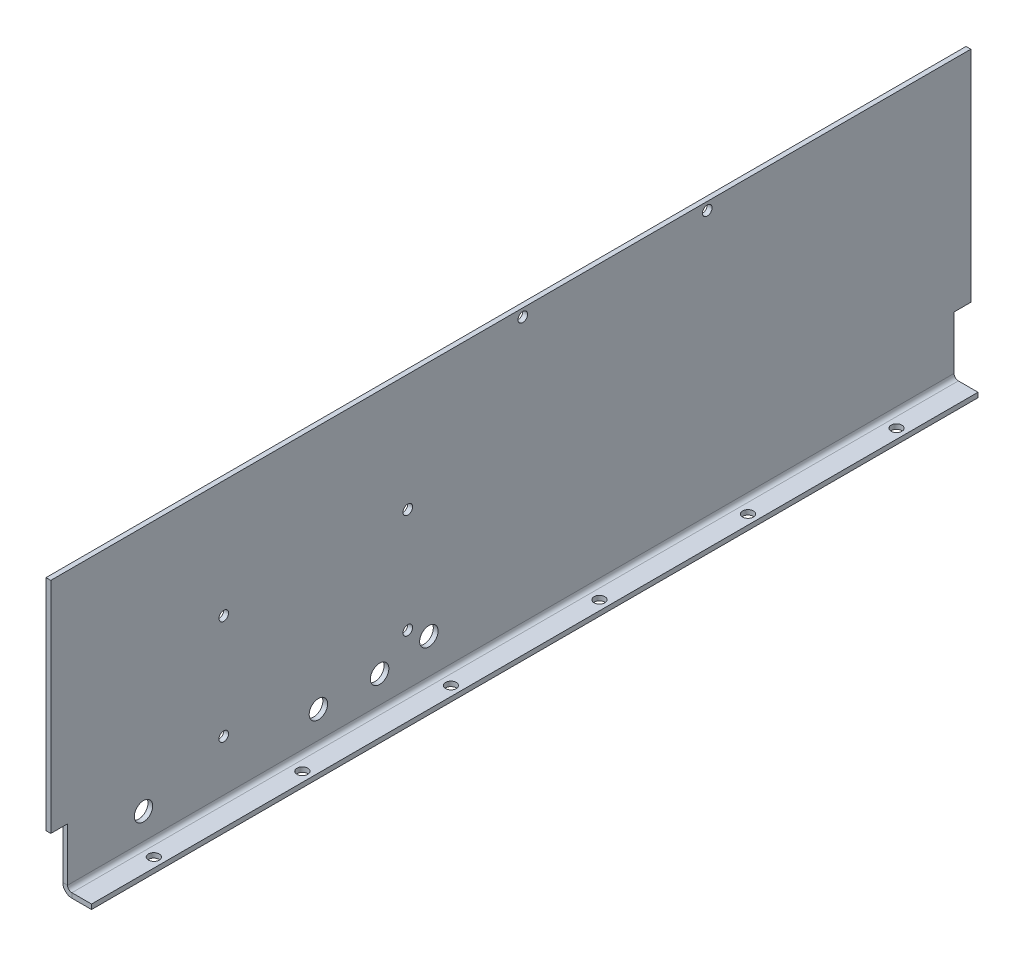
from build123d import *

# Parameters (mm, degrees)
FLANGE_BASE1_DEPTH    = 390
ESBO_O6_R             = 2
ESBO_O6_R_2           = 3.85
ESBO_O6_W             = 10
ESBO_O6_H             = 26
CORTE_EXTRUS_O1_DEPTH = 98
ESBO_O7_R             = 2.25
CORTE_EXTRUS_O2_DEPTH = 98
ESBO_O8_W             = 3
ESBO_O8_H             = 94
CORTE_EXTRUS_O3_DEPTH = 10
ESBO_O9_W             = 384
ESBO_O9_H             = 2.5
CORTE_EXTRUS_O4_DEPTH = 10


# Sheet-metal steps are written as plain solids
with BuildPart() as part:
    # Esboço1 → Flange-base1 (new body)
    with BuildSketch(Plane.XY):
        with BuildLine():
            Line((0, 120), (0, 3.8))
            ThreePointArc((0, 3.8), (1.112994231, 1.112994231), (3.8, 0))
            Line((3.8, 0), (12, 0))
            Line((12, 0), (12, 2))
            Line((12, 2), (3.8, 2))
            ThreePointArc((3.8, 2), (2.527207794, 2.527207794), (2, 3.8))
            Line((2, 3.8), (2, 120))
            Line((2, 120), (0, 120))
        make_face()
    extrude(amount=FLANGE_BASE1_DEPTH)

    # Esboço6 → Corte-extrusão1 (cut)
    with BuildSketch(Plane(origin=(12, 0, 0), x_dir=(0, 0, -1), z_dir=(1, 0, 0))):
        with Locations(Location((-314.8, 25, 0), (0, 0, 90))):
            Circle(ESBO_O6_R)
        with Locations(Location((-314.8, 68.6, 0), (0, 0, 90))):
            Circle(ESBO_O6_R)
        with Locations(Location((-238, 25, 0), (0, 0, 90))):
            Circle(ESBO_O6_R)
        with Locations(Location((-238, 68.6, 0), (0, 0, 90))):
            Circle(ESBO_O6_R)
        with Locations(Location((-275.3, 15.1, 0), (0, 0, 90))):
            Circle(ESBO_O6_R_2)
        with Locations(Location((-249.75, 15.1, 0), (0, 0, 90))):
            Circle(ESBO_O6_R_2)
        with Locations(Location((-229.2, 18.4, 0), (0, 0, 90))):
            Circle(ESBO_O6_R_2)
        with Locations(Location((-190, 114.2, 0), (0, 0, 90))):
            Circle(ESBO_O6_R)
        with Locations(Location((-113, 114.2, 0), (0, 0, 90))):
            Circle(ESBO_O6_R)
        with Locations(Location((-348.3, 14.7, 0), (0, 0, 90))):
            Circle(ESBO_O6_R_2)
        with Locations((-5, 13)):
            Rectangle(ESBO_O6_W, ESBO_O6_H)
        with Locations((-385, 13)):
            Rectangle(ESBO_O6_W, ESBO_O6_H)
    extrude(amount=-CORTE_EXTRUS_O1_DEPTH, mode=Mode.SUBTRACT)

    # Esboço7 → Corte-extrusão2 (cut)
    with BuildSketch(Plane(origin=(0, 2, 0), x_dir=(1, 0, 0), z_dir=(0, 1, 0))):
        with Locations(Location((8, -350, 0), (0, 0, 270))):
            Circle(ESBO_O7_R)
        with Locations(Location((8, -288, 0), (0, 0, 270))):
            Circle(ESBO_O7_R)
        with Locations(Location((8, -226, 0), (0, 0, 270))):
            Circle(ESBO_O7_R)
        with Locations(Location((8, -164, 0), (0, 0, 270))):
            Circle(ESBO_O7_R)
        with Locations(Location((8, -102, 0), (0, 0, 270))):
            Circle(ESBO_O7_R)
        with Locations(Location((8, -40, 0), (0, 0, 270))):
            Circle(ESBO_O7_R)
    extrude(amount=-CORTE_EXTRUS_O2_DEPTH, mode=Mode.SUBTRACT)

    # Esboço8 → Corte-extrusão3 (cut)
    with BuildSketch(Plane.ZY):
        with Locations((1.5, 73)):
            Rectangle(ESBO_O8_W, ESBO_O8_H)
        with Locations((388.5, 73)):
            Rectangle(ESBO_O8_W, ESBO_O8_H)
    extrude(amount=-CORTE_EXTRUS_O3_DEPTH, mode=Mode.SUBTRACT)

    # Esboço9 → Corte-extrusão4 (cut)
    with BuildSketch(Plane(origin=(2, 0, 0), x_dir=(0, 0, -1), z_dir=(1, 0, 0))):
        with Locations((-195, 118.75)):
            Rectangle(ESBO_O9_W, ESBO_O9_H)
    extrude(amount=-CORTE_EXTRUS_O4_DEPTH, mode=Mode.SUBTRACT)


solid = part.part
